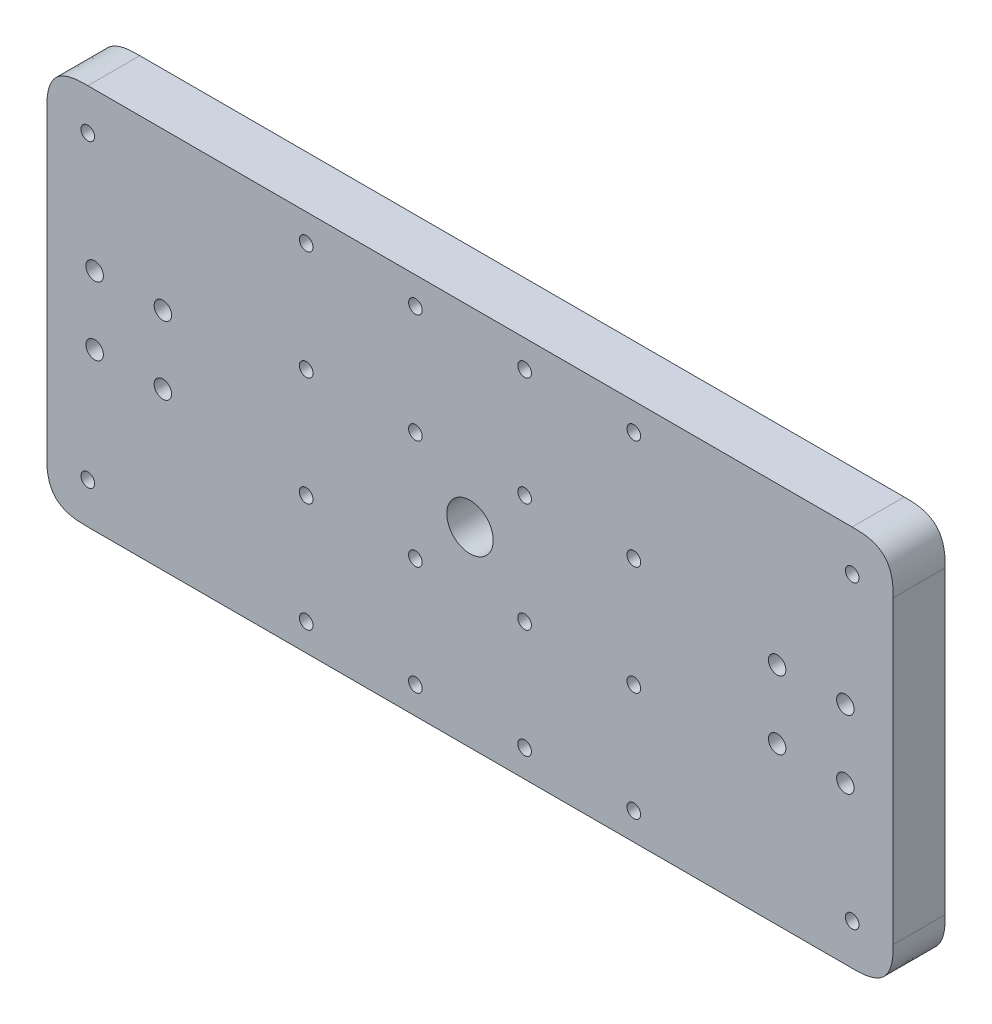
from build123d import *

# Parameters (mm, degrees)
SKETCH1_W                           = 310
SKETCH1_H                           = 140
BOSS_EXTRUDE1_DEPTH                 = 19.05
TAP_DRILL_FOR_M6X1_0_TAP1_D         = 5
LPATTERN1_COUNT                     = 4
LPATTERN1_PITCH                     = 40
LPATTERN1_COUNT_DIR2                = 4
LPATTERN1_PITCH_DIR2                = 40
FILLET1_SIZE                        = 15
M6_CLEARANCE_HOLE1_D                = 6.4
M16_CLEARANCE_HOLE1_D               = 17
TAP_START                           = -1
TAP_DRILL_FOR_M6X1_0_TAP2_OUTLINE_R = 2.5
TAP_DRILL_FOR_M6X1_0_TAP2_DEPTH     = 21


with BuildPart() as part:
    # Sketch1 → Boss-Extrude1 (new body)
    with BuildSketch(Plane.XY):
        Rectangle(SKETCH1_W, SKETCH1_H)
    extrude(amount=BOSS_EXTRUDE1_DEPTH)

    # Tap Drill for M6x1.0 Tap1 (through all)
    with Locations(Plane.XY.offset(19.05)):
        with Locations((-60, 60)):
            tap_drill_for_m6x1_0_tap1 = Hole(TAP_DRILL_FOR_M6X1_0_TAP1_D / 2)

    # LPattern1: Tap Drill for M6x1.0 Tap1 4 × 4
    with Locations(*[(i * LPATTERN1_PITCH, -j * LPATTERN1_PITCH_DIR2, 0) for i in range(LPATTERN1_COUNT) for j in range(LPATTERN1_COUNT_DIR2) if (i, j) != (0, 0)]):
        add(tap_drill_for_m6x1_0_tap1, mode=Mode.SUBTRACT)

    # Fillet1
    # a fillet whose section is not a circle: 15 mm, written as the material it takes off along each edge
    with BuildSketch(Plane(origin=(155, -70, -37.5), x_dir=(0, 1, 0), z_dir=(0, 0, 1)), Plane(origin=(155, 70, -37.5), x_dir=(-1, 0, 0), z_dir=(0, 0, 1))) as fillet1_piece_1:
        with BuildLine():
            add(Edge.make_bspline([(FILLET1_SIZE, 0), (FILLET1_SIZE * 0.831801948466, 0), (FILLET1_SIZE * 0.663603896932, 0), (FILLET1_SIZE * 0.292893218813, FILLET1_SIZE * 0.0716919198361), (FILLET1_SIZE * 0.0716919198361, FILLET1_SIZE * 0.292893218813), (0, FILLET1_SIZE * 0.663603896932), (0, FILLET1_SIZE * 0.831801948466), (0, FILLET1_SIZE)], knots=[0, 0, 0, 0, 0, 0, 0.5, 0.5, 1, 1, 1, 1, 1, 1], degree=5))
            Line((0, FILLET1_SIZE), (0, 0))
            Line((0, 0), (FILLET1_SIZE, 0))
        make_face()
    extrude(amount=94.05, mode=Mode.SUBTRACT)
    with BuildSketch(Plane(origin=(-155, 70, -37.5), x_dir=(1, 0, 0), z_dir=(0, 0, 1)), Plane(origin=(-155, -70, -37.5), x_dir=(0, 1, 0), z_dir=(0, 0, 1))) as fillet1_piece_2:
        with BuildLine():
            add(Edge.make_bspline([(FILLET1_SIZE, 0), (FILLET1_SIZE * 0.831801948466, 0), (FILLET1_SIZE * 0.663603896932, 0), (FILLET1_SIZE * 0.292893218813, -FILLET1_SIZE * 0.0716919198361), (FILLET1_SIZE * 0.0716919198361, -FILLET1_SIZE * 0.292893218813), (0, -FILLET1_SIZE * 0.663603896932), (0, -FILLET1_SIZE * 0.831801948466), (0, -FILLET1_SIZE)], knots=[0, 0, 0, 0, 0, 0, 0.5, 0.5, 1, 1, 1, 1, 1, 1], degree=5))
            Line((0, -FILLET1_SIZE), (0, 0))
            Line((0, 0), (FILLET1_SIZE, 0))
        make_face()
    extrude(amount=94.05, mode=Mode.SUBTRACT)

    # M6 Clearance Hole1 (through all)
    with Locations(Plane(origin=(0, 0, 0), x_dir=(-1, 0, 0), z_dir=(0, 0, -1))):
        with Locations((137.5, -12.5), (137.5, 12.5), (112.5, 12.5), (112.5, -12.5), (-112.5, -12.5), (-137.5, -12.5), (-112.5, 12.5), (-137.5, 12.5)):
            Hole(M6_CLEARANCE_HOLE1_D / 2)

    # M16 Clearance Hole1 (through all)
    with Locations(Plane.XY.offset(19.05)):
        with Locations((0, 0)):
            Hole(M16_CLEARANCE_HOLE1_D / 2)

    # Tap Drill for M6x1.0 Tap2: read off the stored shape, not the designer's step
    # Tap Drill for M6x1.0 Tap2 outline → Tap Drill for M6x1.0 Tap2 (cut)
    with BuildSketch(Plane.XY.offset(TAP_START)):
        with Locations((140, 55)):
            Circle(TAP_DRILL_FOR_M6X1_0_TAP2_OUTLINE_R)
        with Locations((-140, -55)):
            Circle(TAP_DRILL_FOR_M6X1_0_TAP2_OUTLINE_R)
        with Locations((140, -55)):
            Circle(TAP_DRILL_FOR_M6X1_0_TAP2_OUTLINE_R)
        with Locations((-140, 55)):
            Circle(TAP_DRILL_FOR_M6X1_0_TAP2_OUTLINE_R)
    extrude(amount=TAP_DRILL_FOR_M6X1_0_TAP2_DEPTH, mode=Mode.SUBTRACT)


solid = part.part
